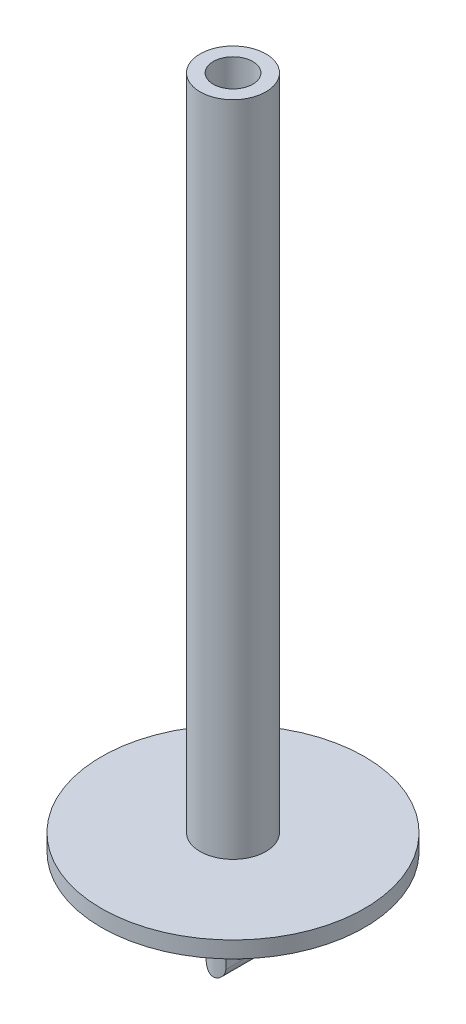
from build123d import *

# Parameters (mm, degrees)
SCHIZZO1_R                   = 6
ESTRUSIONE_ESTRUSIONE1_DEPTH = 30
SCHIZZO2_R                   = 40
ESTRUSIONE_ESTRUSIONE2_DEPTH = 5
SCHIZZO3_R                   = 10
ESTRUSIONE_ESTRUSIONE3_DEPTH = 200
TAGLIO_ESTRUSIONE1_START     = -160
SCHIZZO4_R                   = 6
TAGLIO_ESTRUSIONE1_DEPTH     = 160
SCHIZZO5_W                   = 3
SCHIZZO5_H                   = 13
TAGLIO_ESTRUSIONE2_DEPTH     = 242.712639305
RACCORDO1_R                  = 3


with BuildPart() as part:
    # Schizzo1 → Estrusione-Estrusione1 (new body)
    with BuildSketch(Plane(origin=(0, 0, 0), x_dir=(1, 0, 0), z_dir=(0, 1, 0))):
        with Locations(Location((0, 0, 0), (0, 0, 270))):
            Circle(SCHIZZO1_R)
    extrude(amount=ESTRUSIONE_ESTRUSIONE1_DEPTH)

    # Schizzo2 → Estrusione-Estrusione2 (add)
    with BuildSketch(Plane(origin=(0, 30, 0), x_dir=(1, 0, 0), z_dir=(0, 1, 0))):
        with Locations(Location((0, 0, 0), (0, 0, 270))):
            Circle(SCHIZZO2_R)
    extrude(amount=ESTRUSIONE_ESTRUSIONE2_DEPTH)

    # Schizzo3 → Estrusione-Estrusione3 (add)
    with BuildSketch(Plane(origin=(0, 35, 0), x_dir=(1, 0, 0), z_dir=(0, 1, 0))):
        with Locations(Location((0, 0, 0), (0, 0, 270))):
            Circle(SCHIZZO3_R)
    extrude(amount=ESTRUSIONE_ESTRUSIONE3_DEPTH)

    # Schizzo4 → Taglio-Estrusione1 (cut)
    with BuildSketch(Plane(origin=(0, 235, 0), x_dir=(1, 0, 0), z_dir=(0, 1, 0)).offset(TAGLIO_ESTRUSIONE1_START)):
        with Locations(Location((0, 0, 0), (0, 0, 270))):
            Circle(SCHIZZO4_R)
    extrude(amount=TAGLIO_ESTRUSIONE1_DEPTH, mode=Mode.SUBTRACT)

    # Schizzo5 → Taglio-Estrusione2 (cut, symmetric)
    with BuildSketch(Plane.XY):
        with Locations((4.5, 6.5)):
            Rectangle(SCHIZZO5_W, SCHIZZO5_H)
    taglio_estrusione2 = extrude(amount=TAGLIO_ESTRUSIONE2_DEPTH, both=True, mode=Mode.SUBTRACT)

    # Specchia1: Taglio-Estrusione2 across plane
    add(taglio_estrusione2.mirror(Plane(origin=(0, 0, 0), x_dir=(0, 0, 1), z_dir=(1, 0, 0))), mode=Mode.SUBTRACT)


with BuildPart() as body_2:
    # Schizzo6 → Rivoluzione1 (revolve)
    with BuildSketch(Plane(origin=(0, 0, 0), x_dir=(0, 0, -1), z_dir=(1, 0, 0))):
        with BuildLine():
            Line((-4, 6.058790505), (4, 6.058790505))
            ThreePointArc((4, 6.058790505), (0, 10.058790505), (-4, 6.058790505))
        make_face()
    revolve(axis=Axis((0, 6.058790505, 4), (0, 0, -1)))


with BuildPart() as part_1:
    add(part.part)

    # Abbina1: cut body 2
    add(body_2.part, mode=Mode.SUBTRACT)

    # Raccordo1
    raccordo1_edges = [part_1.edges().sort_by_distance(p)[0] for p in [
        (3, 0, 0),
        (-3, 0, 0),
        (-3, 13, 0),
        (3, 13, 0),
    ]]
    fillet(raccordo1_edges, radius=RACCORDO1_R - 0.0001)  # a hair under: the kernel refuses the full size


solid = part_1.part
